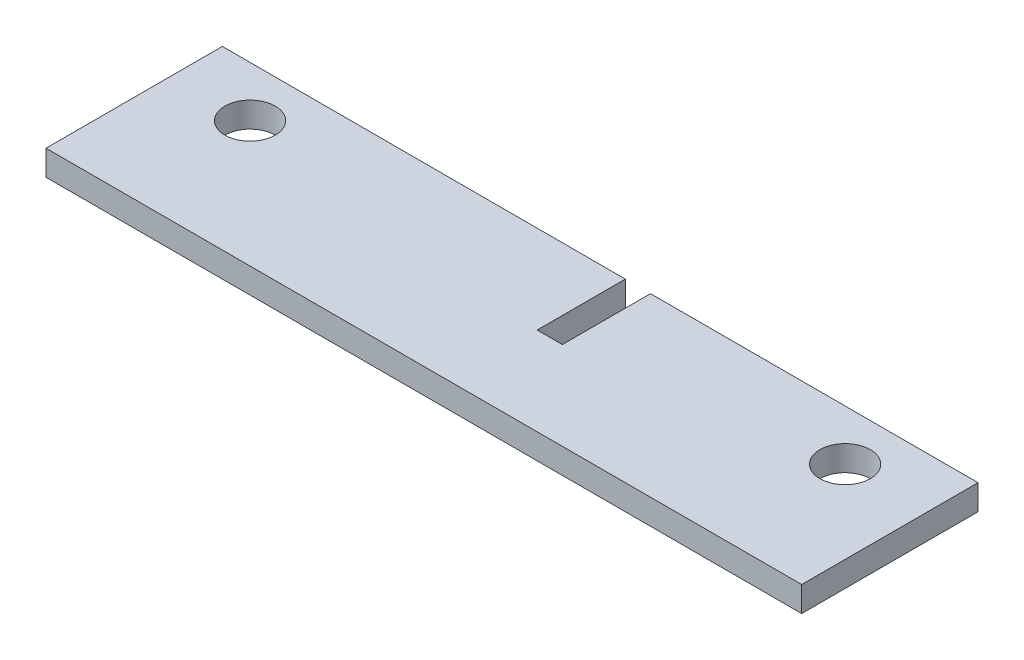
from build123d import *

# Parameters (mm, degrees)
BOSS_EXTRUDE1_DEPTH      = 50.8
BOSS_EXTRUDE1_DEPTH_BACK = 38.1
SKETCH1_W                = 381
SKETCH1_H                = 12.7
SKETCH3_W                = 12.7
SKETCH3_H                = 44.45
CUT_EXTRUDE1_DEPTH       = 2664.230012597
CAVITY1_START            = 52.3
CAVITY1_OUTLINE_R        = 12.7
CAVITY1_DEPTH            = 12.7


# Read off the part's stored shape, not the designer's step: Cavity1
with BuildPart() as part:
    # Sketch1 → Boss-Extrude1 (new, two sides: drawn at the far end of the back side and taken through both)
    with BuildSketch(Plane.XY.offset(287.7).offset(-BOSS_EXTRUDE1_DEPTH_BACK)):
        with Locations((2451.1, 58.65)):
            Rectangle(SKETCH1_W, SKETCH1_H)
    extrude(amount=BOSS_EXTRUDE1_DEPTH + BOSS_EXTRUDE1_DEPTH_BACK)

    # Sketch3 → Cut-Extrude1 (cut, through all)
    with BuildSketch(Plane(origin=(0, 65, 0), x_dir=(1, 0, 0), z_dir=(0, 1, 0))):
        with Locations((2470.15, -271.825)):
            Rectangle(SKETCH3_W, SKETCH3_H)
    extrude(amount=-CUT_EXTRUDE1_DEPTH, mode=Mode.SUBTRACT)

    # Cavity1 outline → Cavity1 (cut)
    with BuildSketch(Plane(origin=(0, 0, 0), x_dir=(1, 0, 0), z_dir=(0, 1, 0)).offset(CAVITY1_START)):
        with Locations((2300, -275)):
            Circle(CAVITY1_OUTLINE_R)
        with Locations((2600, -275)):
            Circle(CAVITY1_OUTLINE_R)
    extrude(amount=CAVITY1_DEPTH, mode=Mode.SUBTRACT)


solid = part.part
